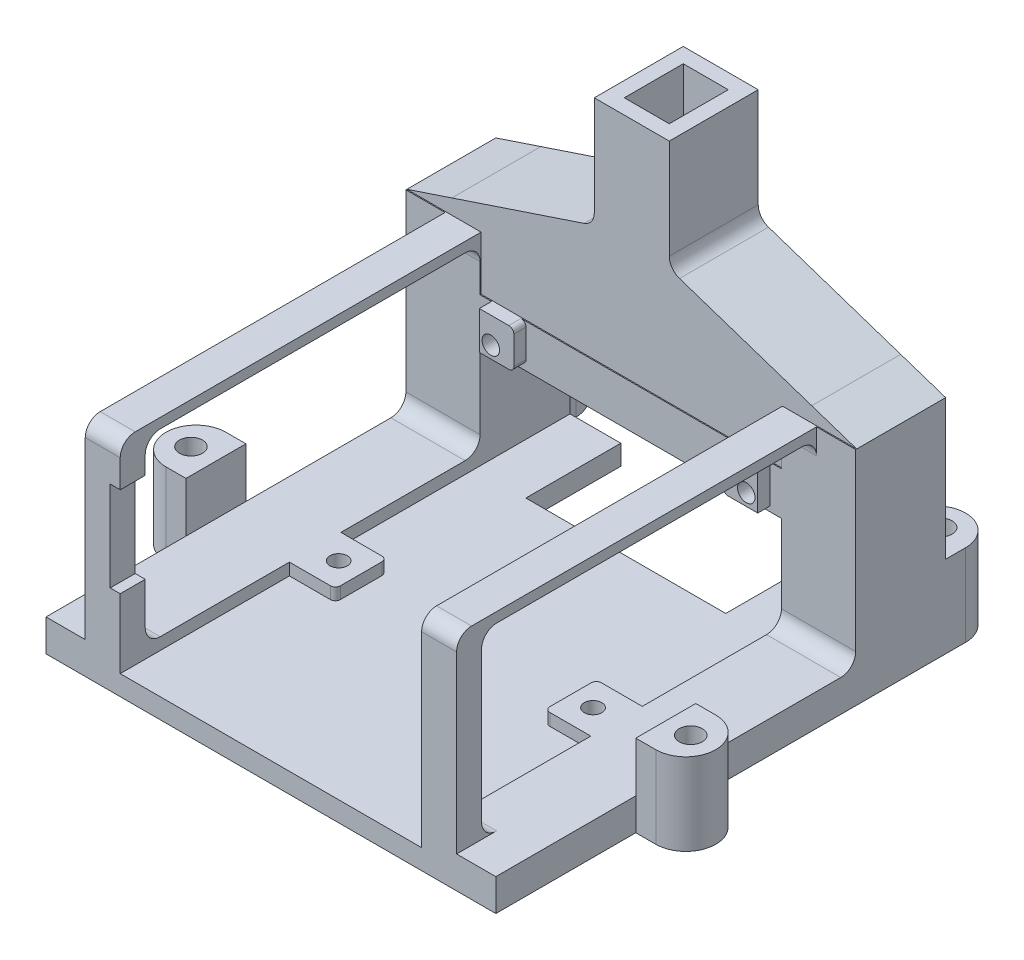
from build123d import *
from OCP.BRepFilletAPI import BRepFilletAPI_MakeChamfer

# Parameters (mm, degrees)
ESQUISSE2_W              = 90
ESQUISSE2_H              = 90
BOSS_EXTRU_1_DEPTH       = 4
ESQUISSE3_W              = 9.2
ESQUISSE3_H              = 10.3
BOSS_EXTRU_2_DEPTH       = 2.4
CONG_1_R                 = 1
ESQUISSE5_W              = 14.85
ESQUISSE5_H              = 90
BOSS_EXTRU_3_DEPTH       = 2.4
ESQUISSE6_W              = 7
ESQUISSE6_H              = 5
BOSS_EXTRU_4_DEPTH       = 38
ESQUISSE8_W              = 14.85
ESQUISSE8_H              = 18
BOSS_EXTRU_5_DEPTH       = 38
BOSS_EXTRU_6_REACH       = 97.814
ESQUISSE9_W              = 7
ESQUISSE9_H              = 2
CONG_1_OF_SYM_TRIE1_R    = 1
ENL_V_MAT_EXTRU_1_REACH  = 111.983
ESQUISSE10_W             = 2
ESQUISSE10_H             = 18
ENL_V_MAT_EXTRU_2_REACH  = 77.38
ESQUISSE11_W             = 40
ESQUISSE11_H             = 18
BOSS_EXTRU_7_REACH       = 100.203
ESQUISSE12_W             = 5
ESQUISSE12_H             = 8.6
ESQUISSE13_W             = 6.9
ESQUISSE13_H             = 7.6
BOSS_EXTRU_8_DEPTH       = 2.45
CONG_2_R                 = 1
CONG_2_OF_SYM_TRIE2_R    = 1
BOSS_EXTRU_9_DEPTH       = 3
BOSS_EXTRU_9_DEPTH_BACK  = 3
ESQUISSE14_W             = 90
ESQUISSE14_H             = 17.8
ESQUISSE15_W             = 15
ESQUISSE15_H             = 17.8
BOSS_EXTRU_10_DEPTH      = 44
ESQUISSE16_W             = 90
ESQUISSE16_H             = 90
BOSS_EXTRU_11_DEPTH      = 11.6
ESQUISSE20_W             = 12
ESQUISSE20_H             = 6.4
BOSS_EXTRU_13_DEPTH      = 10
ESQUISSE21_W             = 12
ESQUISSE21_H             = 6.4
BOSS_EXTRU_14_DEPTH      = 10
CONG_3_R                 = 6
ENL_V_MAT_EXTRU_4_REACH  = 126.022
ESQUISSE23_R             = 2.3
CONG_3_OF_SYM_TRIE3_R    = 6
ENL_V_MAT_EXTRU_5_REACH  = 126.022
ESQUISSE24_R             = 1.75
ENL_V_MAT_EXTRU_6_REACH  = 137.909
ESQUISSE26_R             = 1.75
ESQUISSE27_W             = 50
ESQUISSE27_H             = 4
ENL_V_MAT_EXTRU_7_DEPTH  = 72.2
CHANFREIN3_SIZE          = 28.5
CHANFREIN3_SIZE2         = 9.5
CHANFREIN4_SIZE          = 10
CHANFREIN4_SIZE2         = 17.5
CHANFREIN8_START         = -45
CHANFREIN8_DEPTH         = 17.8
CHANFREIN9_SIZE          = 3
CHANFREIN9_SIZE_2        = 9
CHANFREIN10_START        = 25.930676813
CHANFREIN10_OUTLINE_W    = 40
CHANFREIN10_OUTLINE_H    = 3.16227766
CHANFREIN10_DEPTH        = 2.069323187
CONG_9_R                 = 3
ESQUISSE37_R             = 4
ENL_V_MAT_EXTRU_8_DEPTH  = 3
BOSS_EXTRU_15_DEPTH      = 4.8
CONG_11_R                = 3
CHANFREIN14_SIZE         = 10
CHANFREIN14_SIZE2        = 5
ESQUISSE40_W             = 90
ESQUISSE40_H             = 90
ENL_V_MAT_EXTRU_9_DEPTH  = 24
ESQUISSE41_W             = 9
ESQUISSE41_H             = 11.8
ENL_V_MAT_EXTRU_11_DEPTH = 15.4
BOSS_EXTRU_16_START      = 10
ESQUISSE42_R             = 2.3
BOSS_EXTRU_16_DEPTH      = 10


with BuildPart() as part:
    # Esquisse2 → Boss.-Extru.1 (new body)
    with BuildSketch(Plane(origin=(0, 0, 0), x_dir=(1, 0, 0), z_dir=(0, 1, 0))):
        Rectangle(ESQUISSE2_W, ESQUISSE2_H)
    extrude(amount=BOSS_EXTRU_1_DEPTH)

    # Esquisse3 → Boss.-Extru.2 (add)
    with BuildSketch(Plane(origin=(0, 4, 0), x_dir=(1, 0, 0), z_dir=(0, 1, 0))):
        with Locations((25.55, -6)):
            Rectangle(ESQUISSE3_W, ESQUISSE3_H)
    boss_extru_2 = extrude(amount=BOSS_EXTRU_2_DEPTH)

    # Congé1
    cong_1_edges = [part.edges().sort_by_distance(p)[0] for p in [
        (20.95, 5.2, 0.85),
        (20.95, 5.2, 11.15),
    ]]
    fillet(cong_1_edges, radius=CONG_1_R)

    # Esquisse5 → Boss.-Extru.3 (add)
    with BuildSketch(Plane(origin=(0, 4, 0), x_dir=(1, 0, 0), z_dir=(0, 1, 0))):
        with Locations((37.575, 0)):
            Rectangle(ESQUISSE5_W, ESQUISSE5_H)
    boss_extru_3 = extrude(amount=BOSS_EXTRU_3_DEPTH)

    # Esquisse6 → Boss.-Extru.4 (add)
    with BuildSketch(Plane(origin=(0, 6.4, 0), x_dir=(1, 0, 0), z_dir=(0, 1, 0))):
        with Locations((33.65, -42.5)):
            Rectangle(ESQUISSE6_W, ESQUISSE6_H)
    boss_extru_4 = extrude(amount=BOSS_EXTRU_4_DEPTH)

    # Esquisse8 → Boss.-Extru.5 (add)
    with BuildSketch(Plane(origin=(0, 6.4, 0), x_dir=(1, 0, 0), z_dir=(0, 1, 0))):
        with Locations((37.575, 36)):
            Rectangle(ESQUISSE8_W, ESQUISSE8_H)
    boss_extru_5 = extrude(amount=BOSS_EXTRU_5_DEPTH)

    # Esquisse9 → Boss.-Extru.6 (add, up to next)
    with BuildSketch(Plane.XY.offset(-27), mode=Mode.PRIVATE) as boss_extru_6_sk1:
        with Locations((33.65, 43.4)):
            Rectangle(ESQUISSE9_W, ESQUISSE9_H)
    boss_extru_6_tool1 = extrude(boss_extru_6_sk1.sketch, amount=BOSS_EXTRU_6_REACH, mode=Mode.PRIVATE) - part.part
    boss_extru_6 = boss_extru_6_tool1.solids().sort_by_distance((33.65, 43.4, -27))[0]
    add(boss_extru_6)

    # Symétrie1: Boss.-Extru.2, Boss.-Extru.3, Boss.-Extru.4, Boss.-Extru.5, Boss.-Extru.6 across plane
    add(boss_extru_2.mirror(Plane(origin=(0, 0, 0), x_dir=(0, 0, 1), z_dir=(1, 0, 0))))
    add(boss_extru_3.mirror(Plane(origin=(0, 0, 0), x_dir=(0, 0, 1), z_dir=(1, 0, 0))))
    add(boss_extru_4.mirror(Plane(origin=(0, 0, 0), x_dir=(0, 0, 1), z_dir=(1, 0, 0))))
    add(boss_extru_5.mirror(Plane(origin=(0, 0, 0), x_dir=(0, 0, 1), z_dir=(1, 0, 0))))
    add(boss_extru_6.mirror(Plane(origin=(0, 0, 0), x_dir=(0, 0, 1), z_dir=(1, 0, 0))))

    # Congé1 of Symétrie1
    cong_1_of_sym_trie1_edges = [part.edges().sort_by_distance(p)[0] for p in [
        (-20.95, 5.2, 0.85),
        (-20.95, 5.2, 11.15),
    ]]
    fillet(cong_1_of_sym_trie1_edges, radius=CONG_1_OF_SYM_TRIE1_R)

    # Esquisse10 → Enlèv. mat.-Extru.1 (cut, up to next)
    with BuildSketch(Plane.XY.offset(45), mode=Mode.PRIVATE) as enl_v_mat_extru_1_sk1:
        with Locations((-31.15, 26.85)):
            Rectangle(ESQUISSE10_W, ESQUISSE10_H)
    enl_v_mat_extru_1_tool1 = extrude(enl_v_mat_extru_1_sk1.sketch, amount=-ENL_V_MAT_EXTRU_1_REACH, mode=Mode.PRIVATE) & part.part
    add(enl_v_mat_extru_1_tool1.solids().sort_by_distance((-31.15, 26.85, 45))[0], mode=Mode.SUBTRACT)

    # Esquisse11 → Enlèv. mat.-Extru.2 (cut, up to next)
    with BuildSketch(Plane(origin=(0, 4, 0), x_dir=(1, 0, 0), z_dir=(0, 1, 0)), mode=Mode.PRIVATE) as enl_v_mat_extru_2_sk1:
        with Locations((0, 36)):
            Rectangle(ESQUISSE11_W, ESQUISSE11_H)
    enl_v_mat_extru_2_tool1 = extrude(enl_v_mat_extru_2_sk1.sketch, amount=-ENL_V_MAT_EXTRU_2_REACH, mode=Mode.PRIVATE) & part.part
    add(enl_v_mat_extru_2_tool1.solids().sort_by_distance((0, 4, -36))[0], mode=Mode.SUBTRACT)

    # Esquisse12 → Boss.-Extru.7 (add, up to next)
    with BuildSketch(Plane(origin=(-30.15, 0, 0), x_dir=(0, 0, -1), z_dir=(1, 0, 0)), mode=Mode.PRIVATE) as boss_extru_7_sk1:
        with Locations((29.5, 29.34)):
            Rectangle(ESQUISSE12_W, ESQUISSE12_H)
    boss_extru_7_tool1 = extrude(boss_extru_7_sk1.sketch, amount=BOSS_EXTRU_7_REACH, mode=Mode.PRIVATE) - part.part
    add(boss_extru_7_tool1.solids().sort_by_distance((-30.15, 29.34, -29.5))[0])

    # Esquisse13 → Boss.-Extru.8 (add)
    with BuildSketch(Plane.XY.offset(-27)):
        with Locations((24.4, 29.84)):
            Rectangle(ESQUISSE13_W, ESQUISSE13_H)
    boss_extru_8 = extrude(amount=BOSS_EXTRU_8_DEPTH)

    # Congé2
    cong_2_edges = [part.edges().sort_by_distance(p)[0] for p in [
        (20.95, 33.64, -25.775),
        (20.95, 26.04, -25.775),
    ]]
    fillet(cong_2_edges, radius=CONG_2_R)

    # Symétrie2: Boss.-Extru.8 across plane
    add(boss_extru_8.mirror(Plane(origin=(0, 0, 0), x_dir=(0, 0, 1), z_dir=(1, 0, 0))))

    # Congé2 of Symétrie2
    cong_2_of_sym_trie2_edges = [part.edges().sort_by_distance(p)[0] for p in [
        (-20.95, 33.64, -25.775),
        (-20.95, 26.04, -25.775),
    ]]
    fillet(cong_2_of_sym_trie2_edges, radius=CONG_2_OF_SYM_TRIE2_R)

    # Esquisse14 → Boss.-Extru.9 (add, two sides: drawn at the far end of the back side and taken through both)
    with BuildSketch(Plane(origin=(0, 44.4, 0), x_dir=(1, 0, 0), z_dir=(0, 1, 0)).offset(-BOSS_EXTRU_9_DEPTH_BACK)):
        with Locations((0, 36.1)):
            Rectangle(ESQUISSE14_W, ESQUISSE14_H)
    extrude(amount=BOSS_EXTRU_9_DEPTH + BOSS_EXTRU_9_DEPTH_BACK)

    # Esquisse15 → Boss.-Extru.10 (add)
    with BuildSketch(Plane(origin=(0, 47.4, 0), x_dir=(1, 0, 0), z_dir=(0, 1, 0))):
        with Locations((0, 36.1)):
            Rectangle(ESQUISSE15_W, ESQUISSE15_H)
    extrude(amount=BOSS_EXTRU_10_DEPTH)

    # Esquisse16 → Boss.-Extru.11 (add)
    with BuildSketch(Plane(origin=(0, 91.4, 0), x_dir=(1, 0, 0), z_dir=(0, 1, 0))):
        Rectangle(ESQUISSE16_W, ESQUISSE16_H)
    extrude(amount=BOSS_EXTRU_11_DEPTH)

    # Esquisse20 → Boss.-Extru.13 (add)
    with BuildSketch(Plane(origin=(45, 0, 0), x_dir=(0, 0, -1), z_dir=(1, 0, 0))):
        with Locations((-11, 3.2)):
            Rectangle(ESQUISSE20_W, ESQUISSE20_H)
    boss_extru_13 = extrude(amount=BOSS_EXTRU_13_DEPTH)

    # Esquisse21 → Boss.-Extru.14 (add)
    with BuildSketch(Plane(origin=(0, 0, -45), x_dir=(-1, 0, 0), z_dir=(0, 0, -1))):
        with Locations((-39, 3.2)):
            Rectangle(ESQUISSE21_W, ESQUISSE21_H)
    boss_extru_14 = extrude(amount=BOSS_EXTRU_14_DEPTH)

    # Congé3
    cong_3_edges = [part.edges().sort_by_distance(p)[0] for p in [
        (33, 3.2, -55),
        (45, 3.2, -55),
        (55, 3.2, 5),
        (55, 3.2, 17),
    ]]
    fillet(cong_3_edges, radius=CONG_3_R - 0.0001)  # a hair under: the kernel refuses the full size

    # Esquisse23 → Enlèv. mat.-Extru.4 (cut, up to next)
    with BuildSketch(Plane(origin=(0, 6.4, 0), x_dir=(1, 0, 0), z_dir=(0, 1, 0)), mode=Mode.PRIVATE) as enl_v_mat_extru_4_sk1:
        with Locations(Location((50, -11, 0), (0, 0, 270))):
            Circle(ESQUISSE23_R)
    enl_v_mat_extru_4_tool1 = extrude(enl_v_mat_extru_4_sk1.sketch, amount=-ENL_V_MAT_EXTRU_4_REACH, mode=Mode.PRIVATE) & part.part
    # Esquisse23 → Enlèv. mat.-Extru.4 (cut, up to next)
    with BuildSketch(Plane(origin=(0, 6.4, 0), x_dir=(1, 0, 0), z_dir=(0, 1, 0)), mode=Mode.PRIVATE) as enl_v_mat_extru_4_sk2:
        with Locations(Location((39, 50, 0), (0, 0, 270))):
            Circle(ESQUISSE23_R)
    enl_v_mat_extru_4_tool2 = extrude(enl_v_mat_extru_4_sk2.sketch, amount=-ENL_V_MAT_EXTRU_4_REACH, mode=Mode.PRIVATE) & part.part
    enl_v_mat_extru_4_1 = enl_v_mat_extru_4_tool1.solids().sort_by_distance((50, 6.4, 11))[0]
    add(enl_v_mat_extru_4_1, mode=Mode.SUBTRACT)
    enl_v_mat_extru_4_2 = enl_v_mat_extru_4_tool2.solids().sort_by_distance((39, 6.4, -50))[0]
    add(enl_v_mat_extru_4_2, mode=Mode.SUBTRACT)
    enl_v_mat_extru_4 = enl_v_mat_extru_4_1 + enl_v_mat_extru_4_2  # Enlèv. mat.-Extru.4 as one shape, for the pattern or mirror that repeats it

    # Symétrie3: Boss.-Extru.13, Boss.-Extru.14, Enlèv. mat.-Extru.4 across plane
    add(boss_extru_13.mirror(Plane(origin=(0, 0, 0), x_dir=(0, 0, 1), z_dir=(1, 0, 0))))
    add(boss_extru_14.mirror(Plane(origin=(0, 0, 0), x_dir=(0, 0, 1), z_dir=(1, 0, 0))))
    add(enl_v_mat_extru_4.mirror(Plane(origin=(0, 0, 0), x_dir=(0, 0, 1), z_dir=(1, 0, 0))), mode=Mode.SUBTRACT)

    # Congé3 of Symétrie3
    cong_3_of_sym_trie3_edges = [part.edges().sort_by_distance(p)[0] for p in [
        (-33, 3.2, -55),
        (-45, 3.2, -55),
        (-55, 3.2, 5),
        (-55, 3.2, 17),
    ]]
    fillet(cong_3_of_sym_trie3_edges, radius=CONG_3_OF_SYM_TRIE3_R - 0.0001)  # a hair under: the kernel refuses the full size

    # Esquisse24 → Enlèv. mat.-Extru.5 (cut, up to next)
    with BuildSketch(Plane(origin=(0, 6.4, 0), x_dir=(1, 0, 0), z_dir=(0, 1, 0)), mode=Mode.PRIVATE) as enl_v_mat_extru_5_sk1:
        with Locations(Location((25.45, -6, 0), (0, 0, 270))):
            Circle(ESQUISSE24_R)
    enl_v_mat_extru_5_tool1 = extrude(enl_v_mat_extru_5_sk1.sketch, amount=-ENL_V_MAT_EXTRU_5_REACH, mode=Mode.PRIVATE) & part.part
    enl_v_mat_extru_5 = enl_v_mat_extru_5_tool1.solids().sort_by_distance((25.45, 6.4, 6))[0]
    add(enl_v_mat_extru_5, mode=Mode.SUBTRACT)

    # Esquisse26 → Enlèv. mat.-Extru.6 (cut, up to next)
    with BuildSketch(Plane.XY.offset(-24.55), mode=Mode.PRIVATE) as enl_v_mat_extru_6_sk1:
        with Locations((25.55, 28.44)):
            Circle(ESQUISSE26_R)
    enl_v_mat_extru_6_tool1 = extrude(enl_v_mat_extru_6_sk1.sketch, amount=-ENL_V_MAT_EXTRU_6_REACH, mode=Mode.PRIVATE) & part.part
    enl_v_mat_extru_6 = enl_v_mat_extru_6_tool1.solids().sort_by_distance((25.55, 28.44, -24.55))[0]
    add(enl_v_mat_extru_6, mode=Mode.SUBTRACT)

    # Symétrie5: Enlèv. mat.-Extru.5, Enlèv. mat.-Extru.6 across plane
    add(enl_v_mat_extru_5.mirror(Plane(origin=(0, 0, 0), x_dir=(0, 0, 1), z_dir=(1, 0, 0))), mode=Mode.SUBTRACT)
    add(enl_v_mat_extru_6.mirror(Plane(origin=(0, 0, 0), x_dir=(0, 0, 1), z_dir=(1, 0, 0))), mode=Mode.SUBTRACT)

    # Esquisse27 → Enlèv. mat.-Extru.7 (cut)
    with BuildSketch(Plane.XY.offset(45)):
        with Locations((0, 93.4)):
            Rectangle(ESQUISSE27_W, ESQUISSE27_H)
    extrude(amount=-ENL_V_MAT_EXTRU_7_DEPTH, mode=Mode.SUBTRACT)

    # Chanfrein3: one chamfer whose edges measure the first distance from different faces: ONE call of the kernel's chamfer builder (chamfer() names one face for all edges)
    chanfrein3_edges_1 = [part.edges().sort_by_distance(p)[0] for p in [
        (-7.5, 47.4, -36.1),
    ]]
    chanfrein3_side_1 = [part.faces().sort_by_distance(p)[0] for p in [
        (-26.25, 47.4, -36.1),
    ]]
    chanfrein3_edges_2 = [part.edges().sort_by_distance(p)[0] for p in [
        (7.5, 47.4, -36.1),
    ]]
    chanfrein3_side_2 = [part.faces().sort_by_distance(p)[0] for p in [
        (26.25, 47.4, -36.1),
    ]]
    chanfrein3 = BRepFilletAPI_MakeChamfer(part.part.solid().wrapped)
    for e in chanfrein3_edges_1:
        chanfrein3.Add(CHANFREIN3_SIZE, CHANFREIN3_SIZE2, e.wrapped, chanfrein3_side_1[0].wrapped)  # the first distance lies on this face
    for e in chanfrein3_edges_2:
        chanfrein3.Add(CHANFREIN3_SIZE, CHANFREIN3_SIZE2, e.wrapped, chanfrein3_side_2[0].wrapped)  # the first distance lies on this face
    add(Compound.cast(chanfrein3.Shape()), mode=Mode.REPLACE)

    # Chanfrein4: one chamfer whose edges measure the first distance from different faces: ONE call of the kernel's chamfer builder (chamfer() names one face for all edges)
    chanfrein4_edges_1 = [part.edges().sort_by_distance(p)[0] for p in [
        (7.5, 91.4, -36.1),
    ]]
    chanfrein4_side_1 = [part.faces().sort_by_distance(p)[0] for p in [
        (7.5, 74.15, -36.1),
    ]]
    chanfrein4_edges_2 = [part.edges().sort_by_distance(p)[0] for p in [
        (-7.5, 91.4, -36.1),
    ]]
    chanfrein4_side_2 = [part.faces().sort_by_distance(p)[0] for p in [
        (-7.5, 74.15, -36.1),
    ]]
    chanfrein4 = BRepFilletAPI_MakeChamfer(part.part.solid().wrapped)
    for e in chanfrein4_edges_1:
        chanfrein4.Add(CHANFREIN4_SIZE, CHANFREIN4_SIZE2, e.wrapped, chanfrein4_side_1[0].wrapped)  # the first distance lies on this face
    for e in chanfrein4_edges_2:
        chanfrein4.Add(CHANFREIN4_SIZE, CHANFREIN4_SIZE2, e.wrapped, chanfrein4_side_2[0].wrapped)  # the first distance lies on this face
    add(Compound.cast(chanfrein4.Shape()), mode=Mode.REPLACE)

    # Chanfrein8: read off the stored shape, not the designer's step
    # Chanfrein8 outline → Chanfrein8 (add)
    with BuildSketch(Plane.XY.offset(CHANFREIN8_START)):
        Polygon((30.15, 31.35), (30.15, 41.4), (0, 41.4), align=None)
    extrude(amount=CHANFREIN8_DEPTH)

    # Chanfrein9
    chanfrein9_edges_1 = [part.edges().sort_by_distance(p)[0] for p in [
        (45, 47.4, -36.1),
    ]]
    chanfrein9_side_1 = [part.faces().sort_by_distance(p)[0] for p in [
        (45, 47.34, -36.1),
    ]]
    chanfrein9_edges_2 = [part.edges().sort_by_distance(p)[0] for p in [
        (-45, 47.4, -36.1),
    ]]
    chanfrein9_side_2 = [part.faces().sort_by_distance(p)[0] for p in [
        (-44.94, 47.4, -36.1),
    ]]
    chanfrein9 = BRepFilletAPI_MakeChamfer(part.part.solid().wrapped)
    for e in chanfrein9_edges_1:
        chanfrein9.Add(CHANFREIN9_SIZE - 0.0001, CHANFREIN9_SIZE_2 - 0.0001, e.wrapped, chanfrein9_side_1[0].wrapped)
    for e in chanfrein9_edges_2:
        chanfrein9.Add(CHANFREIN9_SIZE_2 - 0.0001, CHANFREIN9_SIZE - 0.0001, e.wrapped, chanfrein9_side_2[0].wrapped)
    add(Compound.cast(chanfrein9.Shape()), mode=Mode.REPLACE)  # a hair under: the kernel refuses the full size

    # Chanfrein10: read off the stored shape, not the designer's step
    # Chanfrein10 outline → Chanfrein10 (cut)
    with BuildSketch(Plane(origin=(0, 0, 0), x_dir=(1, 0, 0), z_dir=(0, 0.31622776601683705, -0.9486832980505141)).offset(CHANFREIN10_START)):
        with Locations((0, 6.008327554)):
            Rectangle(CHANFREIN10_OUTLINE_W, CHANFREIN10_OUTLINE_H)
    extrude(amount=CHANFREIN10_DEPTH, mode=Mode.SUBTRACT)

    # Congé9
    cong_9_edges = [part.edges().sort_by_distance(p)[0] for p in [
        (-33.65, 44.4, 45),
        (-33.65, 6.4, 40),
        (-37.575, 6.4, -27),
        (-33.65, 42.4, 40),
        (-33.65, 42.4, -27),
        (33.65, 6.4, 40),
        (33.65, 44.4, 45),
        (37.575, 6.4, -27),
        (33.65, 42.4, 40),
        (33.65, 42.4, -27),
    ]]
    fillet(cong_9_edges, radius=CONG_9_R)

    # Chanfrein13
    # the kernel refuses this chamfer: 31.5, 10.5 mm, written as the material it adds along each edge
    with BuildSketch(Plane(origin=(-30.15, 41.4, -27.2), x_dir=(0, -1, 0), z_dir=(0, 0, -1))) as chanfrein13_piece_1:
        with BuildLine():
            Line((10.898446985, 1.195340956), (-0.398446985, -32.695340956))
            Line((-0.398446985, -32.695340956), (-1.028446985, -32.695340956))
            ThreePointArc((-1.028446985, -32.695340956), (-0.63, -16.347670478), (-0.63, 0))
            Line((-0.63, 0), (0, 0.63))
            ThreePointArc((0, 0.63), (5.449223493, 0.63), (10.898446985, 1.825340956))
            Line((10.898446985, 1.825340956), (10.898446985, 1.195340956))
        make_face()
    extrude(amount=17.8)

    # Esquisse37 → Enlèv. mat.-Extru.8 (cut)
    with BuildSketch(Plane.XZ):
        with Locations(Location((-25.45, 6, 0), (0, 0, 270))):
            Circle(ESQUISSE37_R)
        with Locations(Location((25.45, 6, 0), (0, 0, 270))):
            Circle(ESQUISSE37_R)
    extrude(amount=-ENL_V_MAT_EXTRU_8_DEPTH, mode=Mode.SUBTRACT)

    # Esquisse38 → Boss.-Extru.15 (add)
    with BuildSketch(Plane.XY.offset(-27.2)):
        Polygon((0.675, 41.175), (-21.95, 33.64), (23.28, 33.64), align=None)
    extrude(amount=-BOSS_EXTRU_15_DEPTH)

    # Congé11
    cong_11_edges = [part.edges().sort_by_distance(p)[0] for p in [
        (7.5, 56.9, -36.1),
        (-7.5, 56.9, -36.1),
        (-25, 91.4, -36.1),
        (-7.5, 81.4, -36.1),
        (25, 91.4, -36.1),
        (7.5, 81.4, -36.1),
        (30.15, 31.35, -38.5),
        (-30.15, 30.9, -38.5),
        (0.675, 41.175, -38.5),
    ]]
    fillet(cong_11_edges, radius=CONG_11_R)

    # Chanfrein14
    chanfrein14_edges = [part.edges().sort_by_distance(p)[0] for p in [
        (0, 95.4, -27.2),
    ]]
    chanfrein14_side = [part.faces().sort_by_distance(p)[0] for p in [
        (0, 95.4, 8.9),
    ]]
    chamfer(chanfrein14_edges, length=CHANFREIN14_SIZE, length2=CHANFREIN14_SIZE2, reference=chanfrein14_side[0])

    # Esquisse40 → Enlèv. mat.-Extru.9 (cut)
    with BuildSketch(Plane(origin=(0, 103, 0), x_dir=(1, 0, 0), z_dir=(0, 1, 0))):
        Rectangle(ESQUISSE40_W, ESQUISSE40_H)
    extrude(amount=-ENL_V_MAT_EXTRU_9_DEPTH, mode=Mode.SUBTRACT)

    # Esquisse41 → Enlèv. mat.-Extru.11 (cut)
    with BuildSketch(Plane(origin=(0, 79, 0), x_dir=(1, 0, 0), z_dir=(0, 1, 0))):
        with Locations((0, 36.1)):
            Rectangle(ESQUISSE41_W, ESQUISSE41_H)
    extrude(amount=-ENL_V_MAT_EXTRU_11_DEPTH, mode=Mode.SUBTRACT)

    # Esquisse42 → Boss.-Extru.16 (add)
    # profile 1 of 4: a face of its own
    with BuildSketch(Plane(origin=(0, 6.4, 0), x_dir=(1, 0, 0), z_dir=(0, 1, 0)).offset(BOSS_EXTRU_16_START)):
        with BuildLine():
            Line((-45, 49), (-45, 45))
            Line((-45, 45), (-33, 45))
            Line((-33, 45), (-33, 49))
            ThreePointArc((-33, 49), (-34.757359313, 53.242640687), (-39, 55))
            ThreePointArc((-39, 55), (-43.242640687, 53.242640687), (-45, 49))
        make_face()
        with Locations(Location((-39, 50, 0), (0, 0, 270))):
            Circle(ESQUISSE42_R, mode=Mode.SUBTRACT)
    # profile 2 of 4: a face of its own
    with BuildSketch(Plane(origin=(0, 6.4, 0), x_dir=(1, 0, 0), z_dir=(0, 1, 0)).offset(BOSS_EXTRU_16_START)):
        with BuildLine():
            Line((33, 49), (33, 45))
            Line((33, 45), (45, 45))
            Line((45, 45), (45, 49))
            ThreePointArc((45, 49), (43.242640687, 53.242640687), (39, 55))
            ThreePointArc((39, 55), (34.757359313, 53.242640687), (33, 49))
        make_face()
        with Locations(Location((39, 50, 0), (0, 0, 270))):
            Circle(ESQUISSE42_R, mode=Mode.SUBTRACT)
    # profile 3 of 4: a face of its own
    with BuildSketch(Plane(origin=(0, 6.4, 0), x_dir=(1, 0, 0), z_dir=(0, 1, 0)).offset(BOSS_EXTRU_16_START)):
        with BuildLine():
            Line((49, -5), (45, -5))
            Line((45, -5), (45, -17))
            Line((45, -17), (49, -17))
            ThreePointArc((49, -17), (53.242640687, -15.242640687), (55, -11))
            ThreePointArc((55, -11), (53.242640687, -6.757359313), (49, -5))
        make_face()
        with Locations(Location((50, -11, 0), (0, 0, 270))):
            Circle(ESQUISSE42_R, mode=Mode.SUBTRACT)
    # profile 4 of 4: a face of its own
    with BuildSketch(Plane(origin=(0, 6.4, 0), x_dir=(1, 0, 0), z_dir=(0, 1, 0)).offset(BOSS_EXTRU_16_START)):
        with BuildLine():
            Line((-49, -5), (-45, -5))
            Line((-45, -5), (-45, -17))
            Line((-45, -17), (-49, -17))
            ThreePointArc((-49, -17), (-53.242640687, -15.242640687), (-55, -11))
            ThreePointArc((-55, -11), (-53.242640687, -6.757359313), (-49, -5))
        make_face()
        with Locations(Location((-50, -11, 0), (0, 0, 270))):
            Circle(ESQUISSE42_R, mode=Mode.SUBTRACT)
    extrude(amount=-BOSS_EXTRU_16_DEPTH)


solid = part.part
